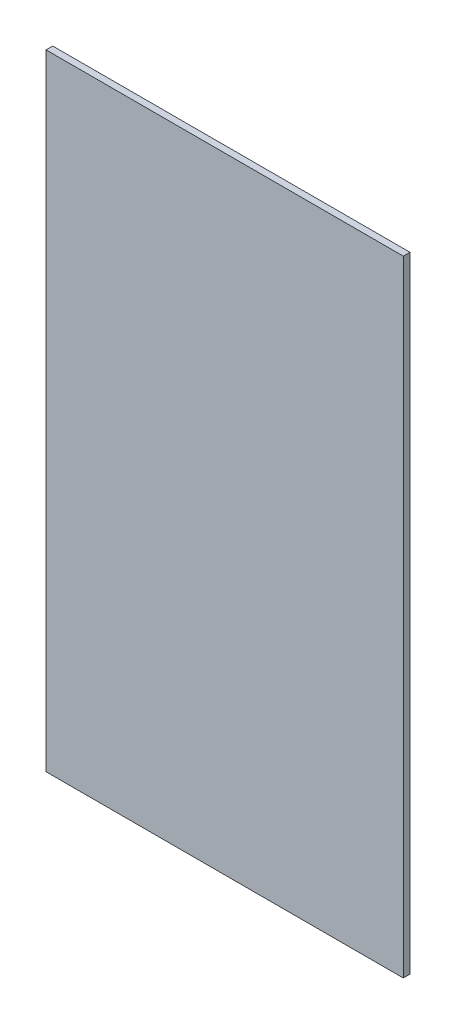
from build123d import *

# Parameters (mm, degrees)
SKETCH1_W           = 160
SKETCH1_H           = 280
BOSS_EXTRUDE1_DEPTH = 1.5


with BuildPart() as part:
    # Sketch1 → Boss-Extrude1 (new, symmetric)
    with BuildSketch(Plane.XY):
        Rectangle(SKETCH1_W, SKETCH1_H)
    extrude(amount=BOSS_EXTRUDE1_DEPTH, both=True)


solid = part.part
